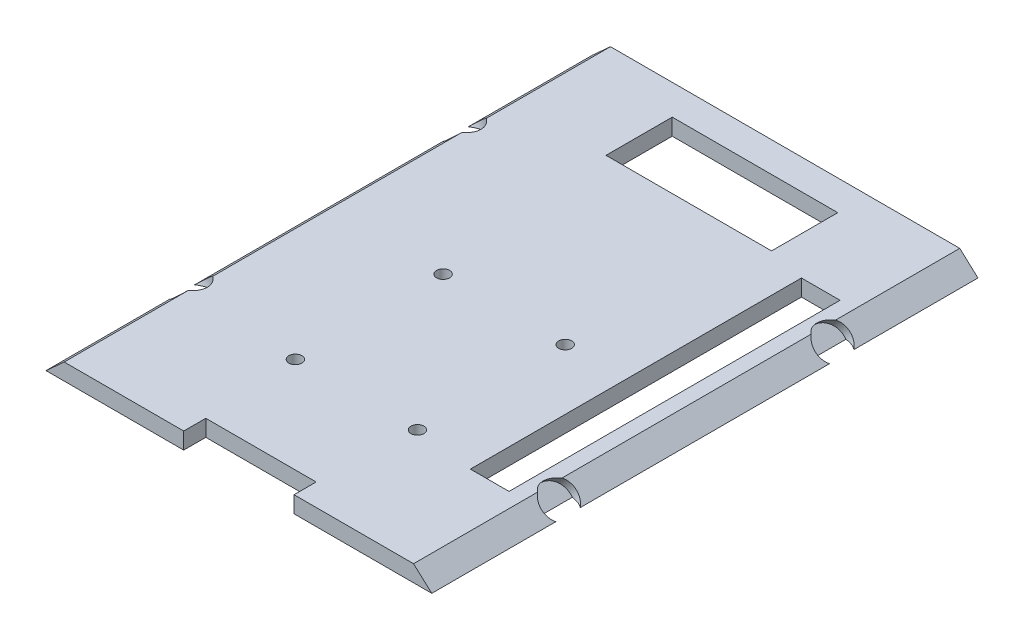
from build123d import *

# Parameters (mm, degrees)
BOSS_EXTRUDE1_DEPTH = 125.73
SKETCH3_W           = 25.4
SKETCH3_H           = 5.08
CUT_EXTRUDE1_DEPTH  = 134.393493158
SKETCH5_W           = 8.89
SKETCH5_H           = 76.2
CUT_EXTRUDE3_DEPTH  = 134.393493158
SKETCH6_W           = 38.1
SKETCH6_H           = 15.24
CUT_EXTRUDE4_DEPTH  = 134.393493158
SKETCH7_R           = 4.0005
CUT_EXTRUDE5_DEPTH  = 2
SKETCH8_R           = 4.0005
CUT_EXTRUDE6_DEPTH  = 2
SKETCH9_R           = 1.5
CUT_EXTRUDE8_DEPTH  = 134.393493158


with BuildPart() as part:
    # Sketch1 → Boss-Extrude1 (new body)
    with BuildSketch(Plane.XY):
        Polygon((-40.203883769, 5.937788296), (40.203883769, 5.937788296), (44.399042974, 2.127788296), (-44.399042974, 2.127788296), align=None)
    extrude(amount=BOSS_EXTRUDE1_DEPTH)

    # Sketch3 → Cut-Extrude1 (cut, through all)
    with BuildSketch(Plane.XZ.offset(-2.127788296)):
        with Locations((0, 123.19)):
            Rectangle(SKETCH3_W, SKETCH3_H)
    extrude(amount=-CUT_EXTRUDE1_DEPTH, mode=Mode.SUBTRACT)

    # Sketch5 → Cut-Extrude3 (cut, through all)
    with BuildSketch(Plane.XZ.offset(-2.127788296)):
        with Locations((32.334042974, 62.23)):
            Rectangle(SKETCH5_W, SKETCH5_H)
    extrude(amount=-CUT_EXTRUDE3_DEPTH, mode=Mode.SUBTRACT)

    # Sketch6 → Cut-Extrude4 (cut, through all)
    with BuildSketch(Plane.XZ.offset(-2.127788296)):
        with Locations((0, 14.553010533)):
            Rectangle(SKETCH6_W, SKETCH6_H)
    extrude(amount=-CUT_EXTRUDE4_DEPTH, mode=Mode.SUBTRACT)

    # Sketch7 → Cut-Extrude5 (cut)
    with BuildSketch(Plane(origin=(21.127225221, 23.263011377, 0), x_dir=(0.7402720771062569, -0.6723074087475075, 0), z_dir=(0.6723074087475075, 0.7402720771062569, 0))):
        with Locations((28.603318705, -94.361)):
            Circle(SKETCH7_R)
        with Locations((28.603318705, -31.369)):
            Circle(SKETCH7_R)
    extrude(amount=-CUT_EXTRUDE5_DEPTH, mode=Mode.SUBTRACT)

    # Sketch8 → Cut-Extrude6 (cut)
    with BuildSketch(Plane(origin=(-21.127225221, 23.263011377, 0), x_dir=(0.7402720771062569, 0.6723074087475075, 0), z_dir=(-0.6723074087475075, 0.7402720771062569, 0))):
        with Locations((-28.603318705, -31.369)):
            Circle(SKETCH8_R)
        with Locations((-28.603318705, -94.361)):
            Circle(SKETCH8_R)
    extrude(amount=-CUT_EXTRUDE6_DEPTH, mode=Mode.SUBTRACT)

    # Sketch9 → Cut-Extrude8 (cut, through all)
    with BuildSketch(Plane(origin=(0, 5.937788296, 0), x_dir=(1, 0, 0), z_dir=(0, 1, 0))):
        with Locations((13.978116231, -98.601597848)):
            Circle(SKETCH9_R)
        with Locations((-14.121883769, -98.601597848)):
            Circle(SKETCH9_R)
        with Locations((-14.121883769, -64.601597848)):
            Circle(SKETCH9_R)
        with Locations((13.978116231, -64.601597848)):
            Circle(SKETCH9_R)
    extrude(amount=-CUT_EXTRUDE8_DEPTH, mode=Mode.SUBTRACT)


solid = part.part
